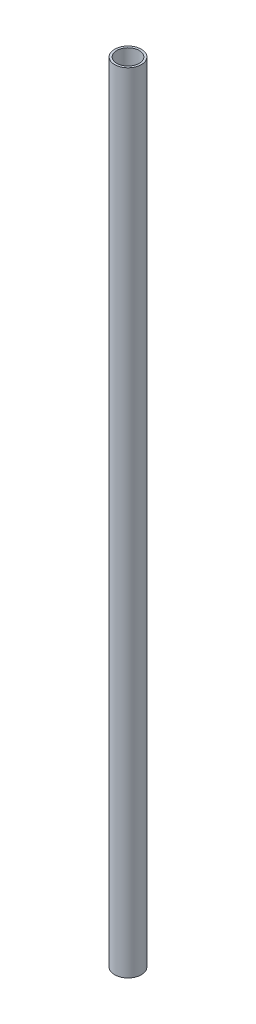
from build123d import *

# Parameters (mm, degrees)
SKETCH1_R           = 12.500000019
SKETCH1_R_2         = 10.499999955
BOSS_EXTRUDE1_DEPTH = 738


with BuildPart() as part:
    # Sketch1 → Boss-Extrude1 (new body)
    with BuildSketch(Plane(origin=(0, 0, 0), x_dir=(1, 0, 0), z_dir=(0, 1, 0))):
        Circle(SKETCH1_R)
        Circle(SKETCH1_R_2, mode=Mode.SUBTRACT)
    extrude(amount=BOSS_EXTRUDE1_DEPTH)


solid = part.part
